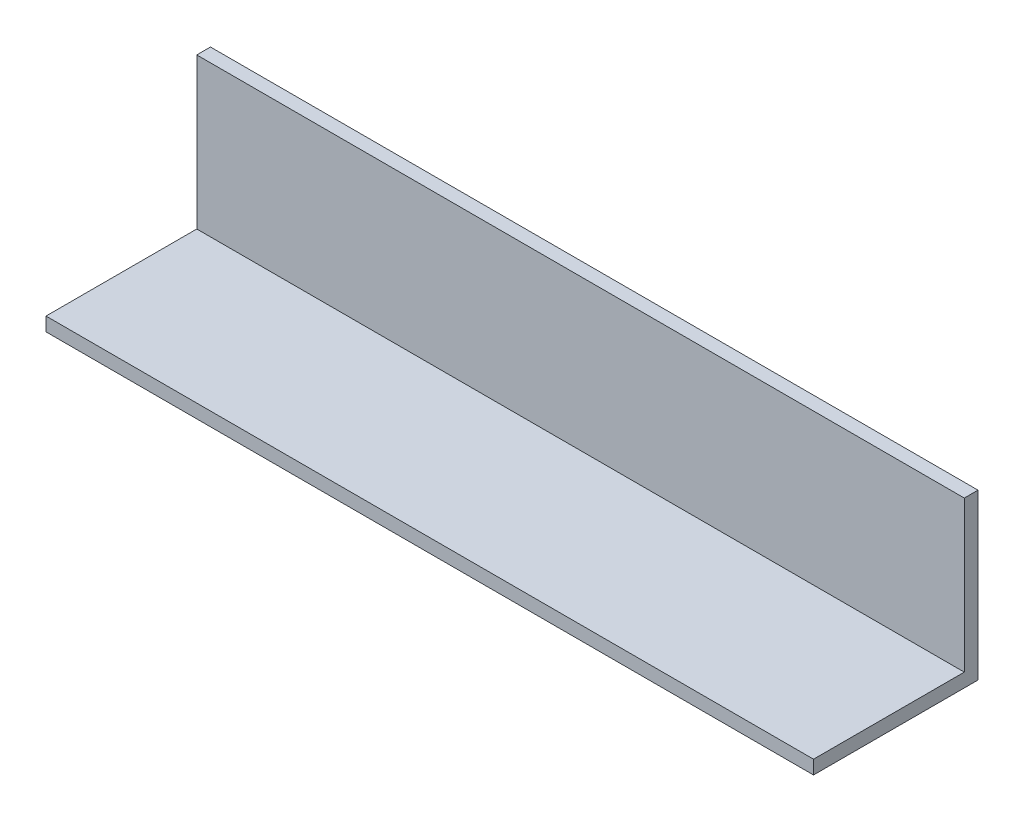
from build123d import *

# Parameters (mm, degrees)
BOSS_EXTRUDE2_DEPTH = 355.6


with BuildPart() as part:
    # Sketch2 → Boss-Extrude2 (new body)
    with BuildSketch(Plane(origin=(0, 0, 0), x_dir=(0, 0, -1), z_dir=(1, 0, 0))):
        Polygon((0, 6.35), (0, 0), (76.2, 0), (76.2, 76.2), (69.85, 76.2), (69.85, 6.35), align=None)
    extrude(amount=BOSS_EXTRUDE2_DEPTH)


solid = part.part
